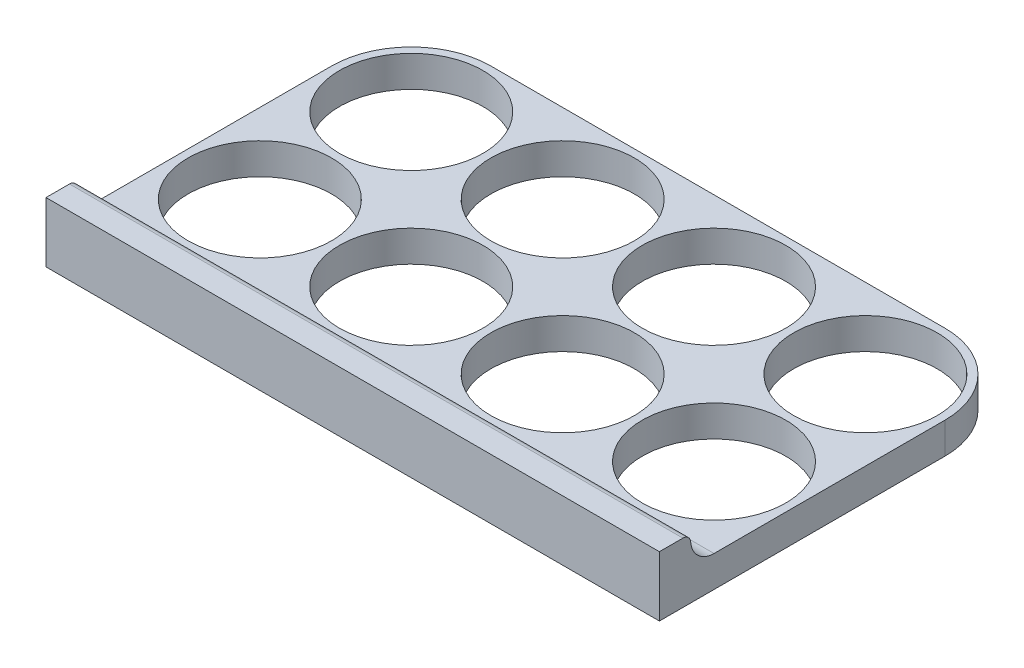
from build123d import *

# Parameters (mm, degrees)
SKETCH1_R           = 9.2
BOSS_EXTRUDE1_DEPTH = 4
SKETCH2_W           = 78.6
SKETCH2_H           = 4
BOSS_EXTRUDE2_DEPTH = 3.7
FILLET1_R           = 3
FILLET2_R           = 1


with BuildPart() as part:
    # Sketch1 → Boss-Extrude1 (new body)
    with BuildSketch(Plane(origin=(0, 0, 0), x_dir=(1, 0, 0), z_dir=(0, 1, 0))):
        with BuildLine():
            Line((-10.2, 0), (-10.2, -17.2))
            Line((-10.2, -17.2), (68.4, -17.2))
            Line((68.4, -17.2), (68.4, 0))
            Line((68.4, 0), (68.4, 19.4))
            ThreePointArc((68.4, 19.4), (65.412489168, 26.612489168), (58.2, 29.6))
            Line((58.2, 29.6), (0, 29.6))
            ThreePointArc((0, 29.6), (-7.212489168, 26.612489168), (-10.2, 19.4))
            Line((-10.2, 19.4), (-10.2, 0))
        make_face()
        Circle(SKETCH1_R, mode=Mode.SUBTRACT)
        with Locations((19.4, 0)):
            Circle(SKETCH1_R, mode=Mode.SUBTRACT)
        with Locations((38.8, 0)):
            Circle(SKETCH1_R, mode=Mode.SUBTRACT)
        with Locations((58.2, 0)):
            Circle(SKETCH1_R, mode=Mode.SUBTRACT)
        with Locations((19.4, 19.4)):
            Circle(SKETCH1_R, mode=Mode.SUBTRACT)
        with Locations((38.8, 19.4)):
            Circle(SKETCH1_R, mode=Mode.SUBTRACT)
        with Locations((58.2, 19.4)):
            Circle(SKETCH1_R, mode=Mode.SUBTRACT)
        with Locations((0, 19.4)):
            Circle(SKETCH1_R, mode=Mode.SUBTRACT)
    extrude(amount=BOSS_EXTRUDE1_DEPTH)

    # Sketch2 → Boss-Extrude2 (add)
    with BuildSketch(Plane(origin=(0, 4, 0), x_dir=(1, 0, 0), z_dir=(0, 1, 0))):
        with Locations((29.1, -15.2)):
            Rectangle(SKETCH2_W, SKETCH2_H)
    extrude(amount=BOSS_EXTRUDE2_DEPTH)

    # Fillet1
    fillet1_edges = [part.edges().sort_by_distance(p)[0] for p in [
        (29.1, 4, 13.2),
    ]]
    fillet(fillet1_edges, radius=FILLET1_R)

    # Fillet2
    fillet2_edges = [part.edges().sort_by_distance(p)[0] for p in [
        (29.1, 7.7, 13.2),
    ]]
    fillet(fillet2_edges, radius=FILLET2_R)


solid = part.part
